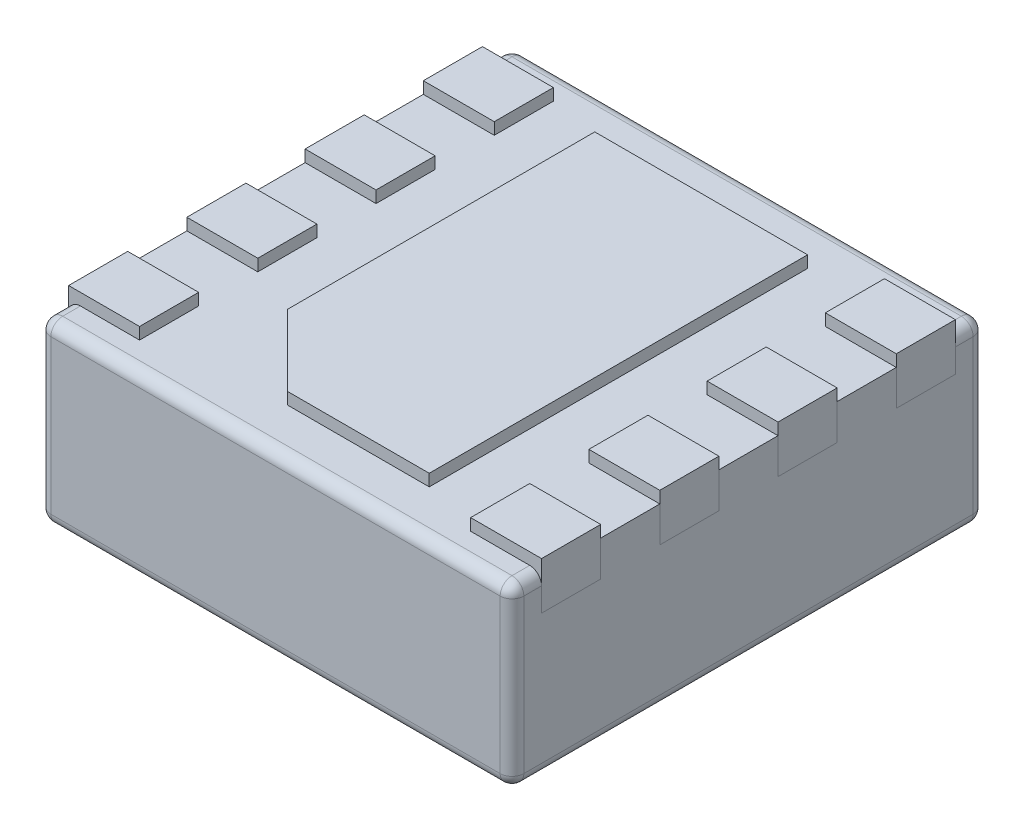
from build123d import *

# Parameters (mm, degrees)
SKETCH1_W                   = 2
SKETCH1_H                   = 2
EXTRUDE1_DEPTH              = 0.375
SKETCH3_W                   = 0.9
SKETCH3_H                   = 1.6
EXTRUDE3_DEPTH              = 0.2
BODY_MOVE_COPY2_START       = -0.45
BODY_MOVE_COPY2_OUTLINE_W   = 0.2
BODY_MOVE_COPY2_OUTLINE_H   = 1.6
BODY_MOVE_COPY2_DEPTH       = 0.9
SKETCH4_W                   = 0.3
SKETCH4_H                   = 0.25
BOSS_EXTRUDE1_DEPTH         = 0.2
LPATTERN1_COUNT             = 3
LPATTERN1_PITCH             = 0.5
LPATTERN1_COL_COUNT         = 2
LPATTERN1_COL_PITCH         = 0.5
BODY_MOVE_COPY3_START       = 0.7
BODY_MOVE_COPY3_OUTLINE_W   = 0.2
BODY_MOVE_COPY3_OUTLINE_H   = 0.25
BODY_MOVE_COPY3_DEPTH       = 0.3
BODY_MOVE_COPY3_2_OUTLINE_W = 0.2
BODY_MOVE_COPY3_2_OUTLINE_H = 0.25
BODY_MOVE_COPY3_2_DEPTH     = 0.3
BODY_MOVE_COPY3_3_OUTLINE_W = 0.2
BODY_MOVE_COPY3_3_OUTLINE_H = 0.25
BODY_MOVE_COPY3_3_DEPTH     = 0.3
BODY_MOVE_COPY3_4_OUTLINE_W = 0.2
BODY_MOVE_COPY3_4_OUTLINE_H = 0.25
BODY_MOVE_COPY3_4_DEPTH     = 0.3
BODY_MOVE_COPY3_START_2     = -1
BODY_MOVE_COPY3_5_OUTLINE_W = 0.2
BODY_MOVE_COPY3_5_OUTLINE_H = 0.25
BODY_MOVE_COPY3_5_DEPTH     = 0.3
BODY_MOVE_COPY3_6_OUTLINE_W = 0.2
BODY_MOVE_COPY3_6_OUTLINE_H = 0.25
BODY_MOVE_COPY3_6_DEPTH     = 0.3
BODY_MOVE_COPY3_7_OUTLINE_W = 0.2
BODY_MOVE_COPY3_7_OUTLINE_H = 0.25
BODY_MOVE_COPY3_7_DEPTH     = 0.3
BODY_MOVE_COPY3_8_OUTLINE_W = 0.2
BODY_MOVE_COPY3_8_OUTLINE_H = 0.25
BODY_MOVE_COPY3_8_DEPTH     = 0.3
FILLET_3_R                  = 0.05
FILLET1_R                   = 0.05
SKETCH_1_R                  = 0.25
CUT_EXTRUDE1_DEPTH          = 0.2
FILLET3_R                   = 0.25
CHAMFER1_SIZE               = 0.3
CHAMFER2_SIZE               = 0.3


with BuildPart() as part:
    # Sketch1 → Extrude1 (new, symmetric)
    with BuildSketch(Plane(origin=(0, 0, 0), x_dir=(1, 0, 0), z_dir=(0, 1, 0))):
        Rectangle(SKETCH1_W, SKETCH1_H)
    extrude(amount=EXTRUDE1_DEPTH, both=True)


with BuildPart() as body_2:
    # Sketch3 → Extrude3 (new body)
    with BuildSketch(Plane(origin=(0, 0.425, 0), x_dir=(1, 0, 0), z_dir=(0, 1, 0))):
        Rectangle(SKETCH3_W, SKETCH3_H)
    extrude(amount=-EXTRUDE3_DEPTH)


with BuildPart() as body_3:
    # Body-Move/Copy2: read off the stored shape, not the designer's step
    # Body-Move/Copy2 outline → Body-Move/Copy2 (new body)
    with BuildSketch(Plane.YZ.offset(BODY_MOVE_COPY2_START)):
        with Locations((0.325, 0)):
            Rectangle(BODY_MOVE_COPY2_OUTLINE_W, BODY_MOVE_COPY2_OUTLINE_H)
    extrude(amount=BODY_MOVE_COPY2_DEPTH)

    # Chamfer1
    chamfer1_edges = [body_3.edges().sort_by_distance(p)[0] for p in [
        (-0.45, 0.325, 0.8),
    ]]
    chamfer(chamfer1_edges, length=CHAMFER1_SIZE)


with BuildPart() as part_1:
    add(part.part)

    # Combine2: cut body 2
    add(body_2.part, mode=Mode.SUBTRACT)


with BuildPart() as body_3_2:
    # Sketch4 → Boss-Extrude1 (new body)
    with BuildSketch(Plane(origin=(0, 0.425, 0), x_dir=(-1, 0, 0), z_dir=(0, 1, 0))):
        with Locations((-0.85, 0.25)):
            Rectangle(SKETCH4_W, SKETCH4_H)
    boss_extrude1 = extrude(amount=-BOSS_EXTRUDE1_DEPTH)


with BuildPart() as lpattern1_1:
    # LPattern1: pattern copy
    add(boss_extrude1.moved(Location(Vector(0, 0, -1) * (1 * LPATTERN1_PITCH))))


with BuildPart() as lpattern1_2:
    # LPattern1: pattern copy
    add(boss_extrude1.moved(Location(Vector(0, 0, -1) * (2 * LPATTERN1_PITCH))))


with BuildPart() as lpattern1_col_1:
    # LPattern1 col: Boss-Extrude1 ×2
    with Locations(*[(0, 0, i * LPATTERN1_COL_PITCH) for i in range(1, LPATTERN1_COL_COUNT)]):
        add(boss_extrude1)


with BuildPart() as body_7:
    # Mirror2: mirrored copy
    add(lpattern1_2.part.mirror(Plane(origin=(0, 0, 0), x_dir=(0, 0, 1), z_dir=(1, 0, 0))))


with BuildPart() as body_8:
    # Mirror2 2: mirrored copy
    add(lpattern1_1.part.mirror(Plane(origin=(0, 0, 0), x_dir=(0, 0, 1), z_dir=(1, 0, 0))))


with BuildPart() as body_9:
    # Mirror2 3: mirrored copy
    add(body_3_2.part.mirror(Plane(origin=(0, 0, 0), x_dir=(0, 0, 1), z_dir=(1, 0, 0))))


with BuildPart() as body_10:
    # Mirror2 4: mirrored copy
    add(lpattern1_col_1.part.mirror(Plane(origin=(0, 0, 0), x_dir=(0, 0, 1), z_dir=(1, 0, 0))))


with BuildPart() as body_11:
    # Body-Move/Copy3: read off the stored shape, not the designer's step
    # Body-Move/Copy3 outline → Body-Move/Copy3 (new body)
    with BuildSketch(Plane.YZ.offset(BODY_MOVE_COPY3_START)):
        with Locations((0.325, -0.75)):
            Rectangle(BODY_MOVE_COPY3_OUTLINE_W, BODY_MOVE_COPY3_OUTLINE_H)
    extrude(amount=BODY_MOVE_COPY3_DEPTH)


with BuildPart() as body_12:
    # Body-Move_Copy3 2 outline → Body-Move_Copy3 2 (new body)
    with BuildSketch(Plane.YZ.offset(BODY_MOVE_COPY3_START)):
        with Locations((0.325, -0.25)):
            Rectangle(BODY_MOVE_COPY3_2_OUTLINE_W, BODY_MOVE_COPY3_2_OUTLINE_H)
    extrude(amount=BODY_MOVE_COPY3_2_DEPTH)


with BuildPart() as body_13:
    # Body-Move_Copy3 3 outline → Body-Move_Copy3 3 (new body)
    with BuildSketch(Plane.YZ.offset(BODY_MOVE_COPY3_START)):
        with Locations((0.325, 0.25)):
            Rectangle(BODY_MOVE_COPY3_3_OUTLINE_W, BODY_MOVE_COPY3_3_OUTLINE_H)
    extrude(amount=BODY_MOVE_COPY3_3_DEPTH)


with BuildPart() as body_14:
    # Body-Move_Copy3 4 outline → Body-Move_Copy3 4 (new body)
    with BuildSketch(Plane.YZ.offset(BODY_MOVE_COPY3_START)):
        with Locations((0.325, 0.75)):
            Rectangle(BODY_MOVE_COPY3_4_OUTLINE_W, BODY_MOVE_COPY3_4_OUTLINE_H)
    extrude(amount=BODY_MOVE_COPY3_4_DEPTH)


with BuildPart() as body_15:
    # Body-Move_Copy3 5 outline → Body-Move_Copy3 5 (new body)
    with BuildSketch(Plane.YZ.offset(BODY_MOVE_COPY3_START_2)):
        with Locations((0.325, 0.75)):
            Rectangle(BODY_MOVE_COPY3_5_OUTLINE_W, BODY_MOVE_COPY3_5_OUTLINE_H)
    extrude(amount=BODY_MOVE_COPY3_5_DEPTH)


with BuildPart() as body_16:
    # Body-Move_Copy3 6 outline → Body-Move_Copy3 6 (new body)
    with BuildSketch(Plane.YZ.offset(BODY_MOVE_COPY3_START_2)):
        with Locations((0.325, 0.25)):
            Rectangle(BODY_MOVE_COPY3_6_OUTLINE_W, BODY_MOVE_COPY3_6_OUTLINE_H)
    extrude(amount=BODY_MOVE_COPY3_6_DEPTH)


with BuildPart() as body_17:
    # Body-Move_Copy3 7 outline → Body-Move_Copy3 7 (new body)
    with BuildSketch(Plane.YZ.offset(BODY_MOVE_COPY3_START_2)):
        with Locations((0.325, -0.25)):
            Rectangle(BODY_MOVE_COPY3_7_OUTLINE_W, BODY_MOVE_COPY3_7_OUTLINE_H)
    extrude(amount=BODY_MOVE_COPY3_7_DEPTH)


with BuildPart() as body_18:
    # Body-Move_Copy3 8 outline → Body-Move_Copy3 8 (new body)
    with BuildSketch(Plane.YZ.offset(BODY_MOVE_COPY3_START_2)):
        with Locations((0.325, -0.75)):
            Rectangle(BODY_MOVE_COPY3_8_OUTLINE_W, BODY_MOVE_COPY3_8_OUTLINE_H)
    extrude(amount=BODY_MOVE_COPY3_8_DEPTH)


with BuildPart() as part_2:
    add(part_1.part)

    # Combine4: read off the stored shape, not the designer's step
    # Combine4: cut LPattern1_2, LPattern1_1, body 3 2, LPattern1 col_1, body 10, body 9, body 8, body 7
    add(lpattern1_2.part, mode=Mode.SUBTRACT)
    add(lpattern1_1.part, mode=Mode.SUBTRACT)
    add(body_3_2.part, mode=Mode.SUBTRACT)
    add(lpattern1_col_1.part, mode=Mode.SUBTRACT)
    add(body_10.part, mode=Mode.SUBTRACT)
    add(body_9.part, mode=Mode.SUBTRACT)
    add(body_8.part, mode=Mode.SUBTRACT)
    add(body_7.part, mode=Mode.SUBTRACT)

    # Скругление3
    fillet_3_edges = [part_2.edges().sort_by_distance(p)[0] for p in [
        (0.45, 0.3, -0.8),
        (-0.45, 0.3, -0.8),
    ]]
    fillet(fillet_3_edges, radius=FILLET_3_R)

    # Fillet1
    fillet1_edges = [part_2.edges().sort_by_distance(p)[0] for p in [
        (-1, 0.375, -0.9375),
        (1, 0.375, -0.9375),
        (0, 0.375, 1),
        (1, 0.375, 0.9375),
        (0, -0.375, 1),
        (-1, -0.375, 0),
        (0, -0.375, -1),
        (1, -0.375, 0),
        (0, 0.375, -1),
        (-1, 0.375, 0.9375),
        (1, 0, 1),
        (-1, 0, 1),
        (-1, 0, -1),
        (1, 0, -1),
    ]]
    fillet(fillet1_edges, radius=FILLET1_R)

    # Эскиз1 → Cut-Extrude1 (cut)
    with BuildSketch(Plane.XZ.offset(0.375)):
        with Locations(Location((-0.5, 0.5, 0), (0, 0, 270))):
            Circle(SKETCH_1_R)
    extrude(amount=-CUT_EXTRUDE1_DEPTH, mode=Mode.SUBTRACT)

    # Fillet3
    # the kernel refuses this fillet: 0.25 mm, written as the material it adds along each edge
    with BuildSketch(Plane(origin=(-0.5, -0.175, 0.5), x_dir=(0, 0, -1), z_dir=(-1, 0, 0))) as fillet3_piece_1:
        with BuildLine():
            CenterArc((0.005051026, 0.25), FILLET3_R, 270, 78.463040967)
            Line((0.005051026, 0), (0.005051026, -0.005))
            Line((0.005051026, -0.005), (0.25, -0.005))
            Line((0.25, -0.005), (0.255, 0))
            ThreePointArc((0.255, 0), (0.255, 0.1), (0.254898979, 0.199))
            Line((0.254898979, 0.199), (0.25, 0.2))
        make_face()
    revolve(axis=Axis((-0.5, -0.175, 0.5), (0, -1, 0)))

    # Chamfer2
    chamfer2_edges = [part_2.edges().sort_by_distance(p)[0] for p in [
        (-0.45, 0.3, 0.8),
    ]]
    chamfer(chamfer2_edges, length=CHAMFER2_SIZE)


solid = Compound([body_3.part, body_11.part, body_12.part, body_13.part, body_14.part, body_15.part, body_16.part, body_17.part, body_18.part, part_2.part])
